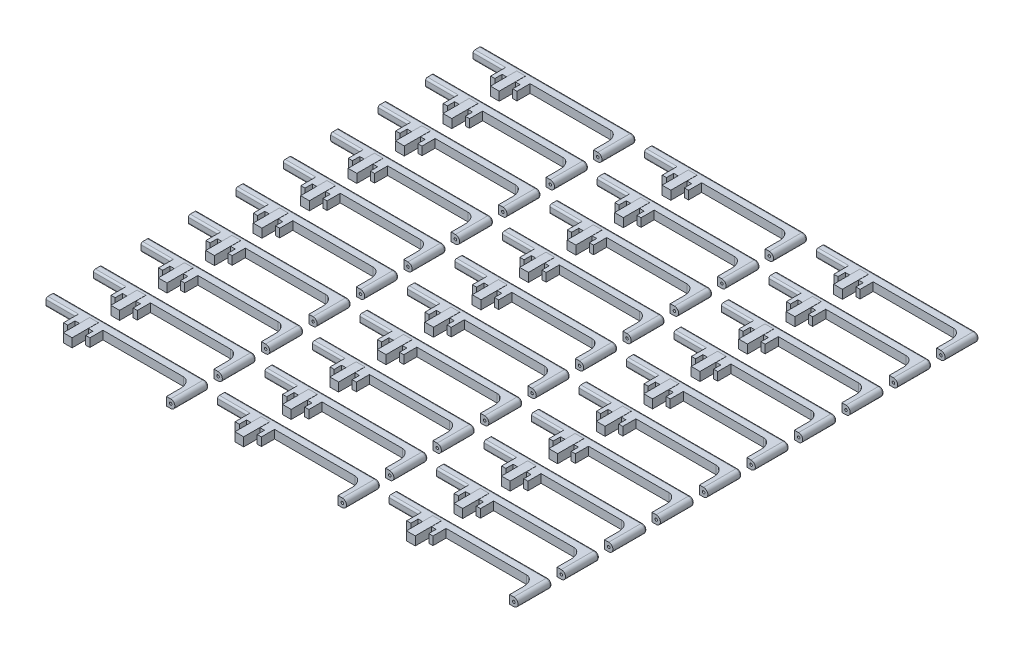
from build123d import *

# Parameters (mm, degrees)
SKETCH_1_W               = 2.4
SKETCH_1_H               = 2.4
EXTRUDE_1_DEPTH          = 7.2
EXTRUDE_2_DEPTH          = 28
EXTRUDE_2_DEPTH_BACK     = 12
SKETCH_4_W               = 2.3
SKETCH_4_H               = 2.3
EXTRUDE_3_DEPTH          = 7
EXTRUDE_3_DEPTH_BACK     = 2.3
SKETCH_5_R               = 0.35
SKETCH_6_R               = 0.35
CUT_EXTRUDE_1_DEPTH      = 10
FILLET_1_SIZE            = 2.4
FILLET_1_SIZE_2          = 3.2
FILLET_2_R               = 0.5
EXTRUDE_START            = -1.5
SKETCH_7_W               = 1.15
SKETCH_7_H               = 0.5
SKETCH_7_H_2             = 1.3
SKETCH_7_H_3             = 2.3
EXTRUDE_4_DEPTH          = 5.1
SKETCH_8_W               = 7.2
SKETCH_8_H               = 2.3
EXTRUDE_5_DEPTH          = 3.1
PATTERN_LINEAR_1_COUNT   = 10
PATTERN_LINEAR_1_PITCH   = 13
PATTERN_LINEAR_1_2_COUNT = 3
PATTERN_LINEAR_1_2_PITCH = 47


with BuildPart() as part:
    # 草图1 → 凸台-拉伸1 (new body)
    with BuildSketch(Plane.XY):
        Rectangle(SKETCH_1_W, SKETCH_1_H)
    extrude(amount=EXTRUDE_1_DEPTH)

    # 草图4 → 凸台-拉伸2 (add, two sides: drawn at the far end of the back side and taken through both)
    with BuildSketch(Plane(origin=(0, 0, 0), x_dir=(0, 0, -1), z_dir=(1, 0, 0)).offset(-EXTRUDE_2_DEPTH_BACK)):
        Rectangle(SKETCH_4_W, SKETCH_4_H)
    extrude(amount=EXTRUDE_2_DEPTH + EXTRUDE_2_DEPTH_BACK)

    # 草图5 → 凸台-拉伸3 (add, two sides: drawn at the far end of the back side and taken through both)
    with BuildSketch(Plane.XY.offset(1.15).offset(-EXTRUDE_3_DEPTH_BACK)):
        with BuildLine():
            Line((28, 0), (28, 1.15))
            Line((28, 1.15), (29.15, 1.15))
            ThreePointArc((29.15, 1.15), (30.3, 0), (29.15, -1.15))
            Line((29.15, -1.15), (28, -1.15))
            Line((28, -1.15), (28, 0))
        make_face()
        with Locations(Location((29.15, 0, 0), (0, 0, 180))):
            Circle(SKETCH_5_R, mode=Mode.SUBTRACT)
    extrude(amount=EXTRUDE_3_DEPTH + EXTRUDE_3_DEPTH_BACK)

    # 草图6 → 切除-拉伸1 (cut)
    with BuildSketch(Plane.ZY.offset(12)):
        Circle(SKETCH_6_R)
    extrude(amount=-CUT_EXTRUDE_1_DEPTH, mode=Mode.SUBTRACT)

    # 圆角1
    # an asymmetric fillet: 3.2, 2.4 mm, written as the material it adds along each edge
    with BuildSketch(Plane(origin=(28, 1.15, 1.15), x_dir=(-1, 0, 0), z_dir=(0, -1, 0))) as fillet_1_piece_1:
        with BuildLine():
            Bezier((FILLET_1_SIZE, 0), (0, 0), (0, -FILLET_1_SIZE_2), weights=[1, 0.707106781, 1])
            Line((0, -FILLET_1_SIZE_2), (0, 0))
            Line((0, 0), (FILLET_1_SIZE, 0))
        make_face()
    extrude(amount=2.3)

    # 圆角2
    fillet_2_edges = [part.edges().sort_by_distance(p)[0] for p in [
        (-6.6, -1.15, 1.15),
        (8.575, -1.15, -1.15),
        (-6.6, 1.15, 1.15),
        (8.575, 1.15, -1.15),
        (30.3, 0, -1.15),
    ]]
    fillet(fillet_2_edges, radius=FILLET_2_R)

    # 草图7 → 凸台-拉伸4 (add)
    with BuildSketch(Plane.XY.offset(1.15).offset(EXTRUDE_START)):
        with Locations((-3.025, 0.9)):
            Rectangle(SKETCH_7_W, SKETCH_7_H)
        with Locations((-3.025, 0)):
            Rectangle(SKETCH_7_W, SKETCH_7_H_2)
        with Locations((-3.025, -0.9)):
            Rectangle(SKETCH_7_W, SKETCH_7_H)
        with Locations((3.025, 0)):
            Rectangle(SKETCH_7_W, SKETCH_7_H_3)
    extrude(amount=EXTRUDE_4_DEPTH)

    # 草图8 → 凸台-拉伸5 (add)
    with BuildSketch(Plane.XY.offset(1.15).offset(EXTRUDE_START)):
        Rectangle(SKETCH_8_W, SKETCH_8_H)
    extrude(amount=EXTRUDE_5_DEPTH)


with BuildPart() as pattern_linear_1_1:
    # 阵列(线性)1: pattern copy
    add(part.part.moved(Location(Vector(0, 0, 1) * (1 * PATTERN_LINEAR_1_PITCH))))


with BuildPart() as pattern_linear_1_2:
    # 阵列(线性)1: pattern copy
    add(part.part.moved(Location(Vector(0, 0, 1) * (2 * PATTERN_LINEAR_1_PITCH))))


with BuildPart() as pattern_linear_1_3:
    # 阵列(线性)1: pattern copy
    add(part.part.moved(Location(Vector(0, 0, 1) * (3 * PATTERN_LINEAR_1_PITCH))))


with BuildPart() as pattern_linear_1_4:
    # 阵列(线性)1: pattern copy
    add(part.part.moved(Location(Vector(0, 0, 1) * (4 * PATTERN_LINEAR_1_PITCH))))


with BuildPart() as pattern_linear_1_5:
    # 阵列(线性)1: pattern copy
    add(part.part.moved(Location(Vector(0, 0, 1) * (5 * PATTERN_LINEAR_1_PITCH))))


with BuildPart() as pattern_linear_1_6:
    # 阵列(线性)1: pattern copy
    add(part.part.moved(Location(Vector(0, 0, 1) * (6 * PATTERN_LINEAR_1_PITCH))))


with BuildPart() as pattern_linear_1_7:
    # 阵列(线性)1: pattern copy
    add(part.part.moved(Location(Vector(0, 0, 1) * (7 * PATTERN_LINEAR_1_PITCH))))


with BuildPart() as pattern_linear_1_8:
    # 阵列(线性)1: pattern copy
    add(part.part.moved(Location(Vector(0, 0, 1) * (8 * PATTERN_LINEAR_1_PITCH))))


with BuildPart() as pattern_linear_1_9:
    # 阵列(线性)1: pattern copy
    add(part.part.moved(Location(Vector(0, 0, 1) * (9 * PATTERN_LINEAR_1_PITCH))))


with BuildPart() as pattern_linear_1_2_1:
    # Pattern Linear 1 2: pattern copy
    add(part.part.moved(Location(Vector(1, 0, 0) * (1 * PATTERN_LINEAR_1_2_PITCH))))


with BuildPart() as pattern_linear_1_2_2:
    # Pattern Linear 1 2: pattern copy
    add(part.part.moved(Location(Vector(1, 0, 0) * (2 * PATTERN_LINEAR_1_2_PITCH))))


with BuildPart() as pattern_linear_1_2_3:
    # Pattern Linear 1 2: pattern copy
    add(pattern_linear_1_1.part.moved(Location(Vector(1, 0, 0) * (1 * PATTERN_LINEAR_1_2_PITCH))))


with BuildPart() as pattern_linear_1_2_4:
    # Pattern Linear 1 2: pattern copy
    add(pattern_linear_1_1.part.moved(Location(Vector(1, 0, 0) * (2 * PATTERN_LINEAR_1_2_PITCH))))


with BuildPart() as pattern_linear_1_2_5:
    # Pattern Linear 1 2: pattern copy
    add(pattern_linear_1_2.part.moved(Location(Vector(1, 0, 0) * (1 * PATTERN_LINEAR_1_2_PITCH))))


with BuildPart() as pattern_linear_1_2_6:
    # Pattern Linear 1 2: pattern copy
    add(pattern_linear_1_2.part.moved(Location(Vector(1, 0, 0) * (2 * PATTERN_LINEAR_1_2_PITCH))))


with BuildPart() as pattern_linear_1_2_7:
    # Pattern Linear 1 2: pattern copy
    add(pattern_linear_1_3.part.moved(Location(Vector(1, 0, 0) * (1 * PATTERN_LINEAR_1_2_PITCH))))


with BuildPart() as pattern_linear_1_2_8:
    # Pattern Linear 1 2: pattern copy
    add(pattern_linear_1_3.part.moved(Location(Vector(1, 0, 0) * (2 * PATTERN_LINEAR_1_2_PITCH))))


with BuildPart() as pattern_linear_1_2_9:
    # Pattern Linear 1 2: pattern copy
    add(pattern_linear_1_4.part.moved(Location(Vector(1, 0, 0) * (1 * PATTERN_LINEAR_1_2_PITCH))))


with BuildPart() as pattern_linear_1_2_10:
    # Pattern Linear 1 2: pattern copy
    add(pattern_linear_1_4.part.moved(Location(Vector(1, 0, 0) * (2 * PATTERN_LINEAR_1_2_PITCH))))


with BuildPart() as pattern_linear_1_2_11:
    # Pattern Linear 1 2: pattern copy
    add(pattern_linear_1_5.part.moved(Location(Vector(1, 0, 0) * (1 * PATTERN_LINEAR_1_2_PITCH))))


with BuildPart() as pattern_linear_1_2_12:
    # Pattern Linear 1 2: pattern copy
    add(pattern_linear_1_5.part.moved(Location(Vector(1, 0, 0) * (2 * PATTERN_LINEAR_1_2_PITCH))))


with BuildPart() as pattern_linear_1_2_13:
    # Pattern Linear 1 2: pattern copy
    add(pattern_linear_1_6.part.moved(Location(Vector(1, 0, 0) * (1 * PATTERN_LINEAR_1_2_PITCH))))


with BuildPart() as pattern_linear_1_2_14:
    # Pattern Linear 1 2: pattern copy
    add(pattern_linear_1_6.part.moved(Location(Vector(1, 0, 0) * (2 * PATTERN_LINEAR_1_2_PITCH))))


with BuildPart() as pattern_linear_1_2_15:
    # Pattern Linear 1 2: pattern copy
    add(pattern_linear_1_7.part.moved(Location(Vector(1, 0, 0) * (1 * PATTERN_LINEAR_1_2_PITCH))))


with BuildPart() as pattern_linear_1_2_16:
    # Pattern Linear 1 2: pattern copy
    add(pattern_linear_1_7.part.moved(Location(Vector(1, 0, 0) * (2 * PATTERN_LINEAR_1_2_PITCH))))


with BuildPart() as pattern_linear_1_2_17:
    # Pattern Linear 1 2: pattern copy
    add(pattern_linear_1_8.part.moved(Location(Vector(1, 0, 0) * (1 * PATTERN_LINEAR_1_2_PITCH))))


with BuildPart() as pattern_linear_1_2_18:
    # Pattern Linear 1 2: pattern copy
    add(pattern_linear_1_8.part.moved(Location(Vector(1, 0, 0) * (2 * PATTERN_LINEAR_1_2_PITCH))))


with BuildPart() as pattern_linear_1_2_19:
    # Pattern Linear 1 2: pattern copy
    add(pattern_linear_1_9.part.moved(Location(Vector(1, 0, 0) * (1 * PATTERN_LINEAR_1_2_PITCH))))


with BuildPart() as pattern_linear_1_2_20:
    # Pattern Linear 1 2: pattern copy
    add(pattern_linear_1_9.part.moved(Location(Vector(1, 0, 0) * (2 * PATTERN_LINEAR_1_2_PITCH))))


solid = Compound([part.part, pattern_linear_1_1.part, pattern_linear_1_2.part, pattern_linear_1_3.part, pattern_linear_1_4.part, pattern_linear_1_5.part, pattern_linear_1_6.part, pattern_linear_1_7.part, pattern_linear_1_8.part, pattern_linear_1_9.part, pattern_linear_1_2_1.part, pattern_linear_1_2_2.part, pattern_linear_1_2_3.part, pattern_linear_1_2_4.part, pattern_linear_1_2_5.part, pattern_linear_1_2_6.part, pattern_linear_1_2_7.part, pattern_linear_1_2_8.part, pattern_linear_1_2_9.part, pattern_linear_1_2_10.part, pattern_linear_1_2_11.part, pattern_linear_1_2_12.part, pattern_linear_1_2_13.part, pattern_linear_1_2_14.part, pattern_linear_1_2_15.part, pattern_linear_1_2_16.part, pattern_linear_1_2_17.part, pattern_linear_1_2_18.part, pattern_linear_1_2_19.part, pattern_linear_1_2_20.part])
